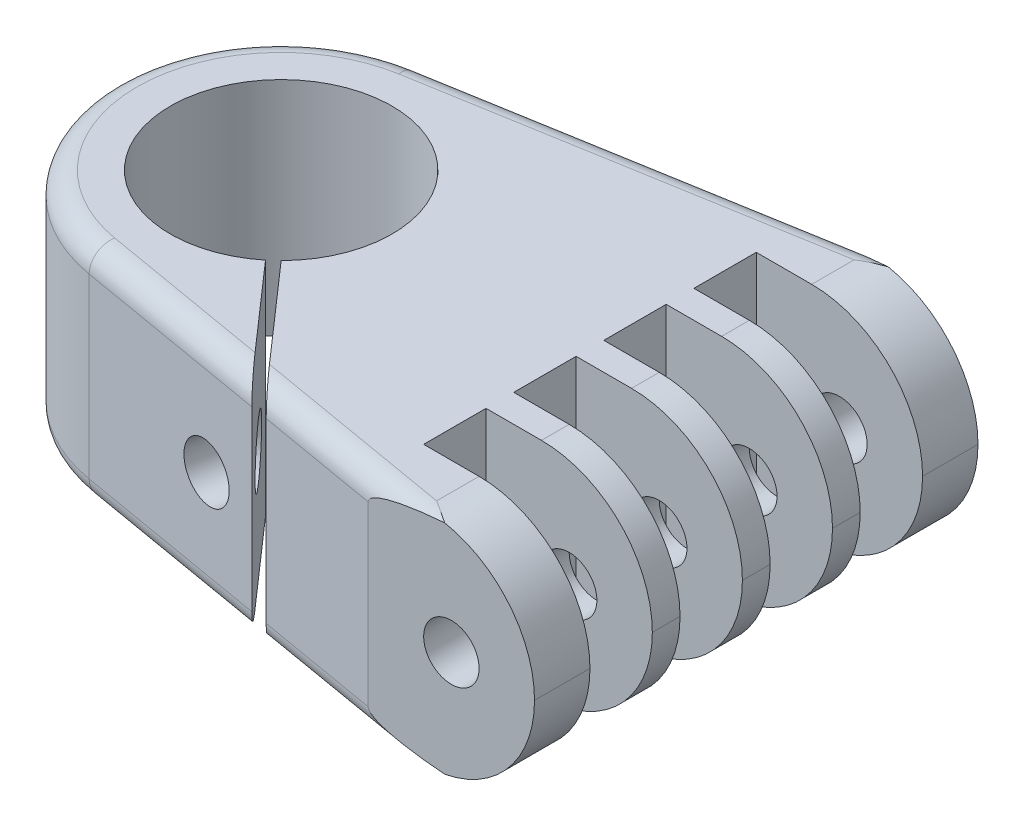
from build123d import *

# Parameters (mm, degrees)
BOSS_EXTRUDE1_DEPTH = 20
FILLET1_R           = 10
SKETCH2_R           = 2.5
CUT_EXTRUDE1_DEPTH  = 40
FILLET2_R           = 2
SKETCH3_R           = 2.5
CUT_EXTRUDE2_DEPTH  = 10


# Some blends are built 0.0001 mm under size
with BuildPart() as part:
    # Sketch1 → Boss-Extrude1 (new body)
    with BuildSketch(Plane(origin=(0, 0, 0), x_dir=(1, 0, 0), z_dir=(0, 1, 0))):
        with BuildLine():
            Line((27.849705815, 9.375), (27.849705815, 15))
            Line((27.849705815, 15), (42.849705815, 15))
            Line((42.849705815, 15), (42.849705815, 20))
            Line((42.849705815, 20), (27.849705815, 20))
            Line((27.849705815, 20), (-2.537743238, 14.78377013))
            ThreePointArc((-2.537743238, 14.78377013), (-15, 0), (-2.537743238, -14.78377013))
            Line((-2.537743238, -14.78377013), (15.176440556, -17.824540498))
            Line((15.176440556, -17.824540498), (6.327966589, -7.743180151))
            ThreePointArc((6.327966589, -7.743180151), (-6.707251498, 7.417059885), (7.069754095, -7.072381285))
            Line((7.069754095, -7.072381285), (16.743020962, -18.093455585))
            Line((16.743020962, -18.093455585), (27.849705815, -20))
            Line((27.849705815, -20), (42.849705815, -20))
            Line((42.849705815, -20), (42.849705815, -15))
            Line((42.849705815, -15), (27.849705815, -15))
            Line((27.849705815, -15), (27.849705815, -9.375))
            Line((27.849705815, -9.375), (42.849705815, -9.375))
            Line((42.849705815, -9.375), (42.849705815, -6.875))
            Line((42.849705815, -6.875), (27.849705815, -6.875))
            Line((27.849705815, -6.875), (27.849705815, -1.25))
            Line((27.849705815, -1.25), (42.849705815, -1.25))
            Line((42.849705815, -1.25), (42.849705815, 1.25))
            Line((42.849705815, 1.25), (27.849705815, 1.25))
            Line((27.849705815, 1.25), (27.849705815, 6.875))
            Line((27.849705815, 6.875), (42.849705815, 6.875))
            Line((42.849705815, 6.875), (42.849705815, 9.375))
            Line((42.849705815, 9.375), (27.849705815, 9.375))
        make_face()
    extrude(amount=BOSS_EXTRUDE1_DEPTH)

    # Fillet1
    fillet1_edges = [part.edges().sort_by_distance(p)[0] for p in [
        (42.849705815, 0, 17.5),
        (42.849705815, 0, 8.125),
        (42.849705815, 0, 0),
        (42.849705815, 0, -8.125),
        (42.849705815, 0, -17.5),
        (42.849705815, 20, -17.5),
        (42.849705815, 20, -8.125),
        (42.849705815, 20, 0),
        (42.849705815, 20, 8.125),
        (42.849705815, 20, 17.5),
    ]]
    fillet(fillet1_edges, radius=FILLET1_R - 0.0001)  # a hair under: the kernel refuses the full size

    # Sketch2 → Cut-Extrude1 (cut)
    with BuildSketch(Plane(origin=(0, 0, -20), x_dir=(-1, 0, 0), z_dir=(0, 0, -1))):
        with Locations((-35.349705815, 10)):
            Circle(SKETCH2_R)
    extrude(amount=-CUT_EXTRUDE1_DEPTH, mode=Mode.SUBTRACT)

    # Fillet2
    # the kernel refuses this fillet: 2 mm, written as the material it takes off along each edge
    with BuildSketch(Plane(origin=(39.676721919, 0, -22.03019459), x_dir=(0.16918288251037936, 0, 0.9855846753402162), z_dir=(-0.9855846753402161, 0, 0.16918288251037933))) as fillet2_piece_1:
        with BuildLine():
            CenterArc((FILLET2_R, FILLET2_R), FILLET2_R, 180, 90)
            Line((0, FILLET2_R), (-FILLET2_R * 0.02, FILLET2_R))
            Line((-FILLET2_R * 0.02, FILLET2_R), (-FILLET2_R * 0.02, -FILLET2_R * 0.02))
            Line((-FILLET2_R * 0.02, -FILLET2_R * 0.02), (FILLET2_R, -FILLET2_R * 0.02))
            Line((FILLET2_R, -FILLET2_R * 0.02), (FILLET2_R, 0))
        make_face()
    extrude(amount=42.831900914, mode=Mode.SUBTRACT)
    with BuildSketch(Plane(origin=(-2.537743238, 0, 14.78377013), x_dir=(0.16918288251037944, 0, -0.9855846753402161), z_dir=(0.9855846753402161, 0, 0.16918288251037944))) as fillet2_piece_2:
        with BuildLine():
            CenterArc((FILLET2_R, FILLET2_R), FILLET2_R, 180, 90)
            Line((0, FILLET2_R), (-FILLET2_R * 0.02, FILLET2_R))
            Line((-FILLET2_R * 0.02, FILLET2_R), (-FILLET2_R * 0.02, -FILLET2_R * 0.02))
            Line((-FILLET2_R * 0.02, -FILLET2_R * 0.02), (FILLET2_R, -FILLET2_R * 0.02))
            Line((FILLET2_R, -FILLET2_R * 0.02), (FILLET2_R, 0))
        make_face()
    extrude(amount=29.973274379, mode=Mode.SUBTRACT)
    with BuildSketch(Plane(origin=(39.676721919, 20, -22.03019459), x_dir=(0.16918288251037936, 0, 0.9855846753402162), z_dir=(-0.9855846753402161, 0, 0.16918288251037933))) as fillet2_piece_3:
        with BuildLine():
            CenterArc((FILLET2_R, -FILLET2_R), FILLET2_R, 90, 90)
            Line((0, -FILLET2_R), (-FILLET2_R * 0.02, -FILLET2_R))
            Line((-FILLET2_R * 0.02, -FILLET2_R), (-FILLET2_R * 0.02, FILLET2_R * 0.02))
            Line((-FILLET2_R * 0.02, FILLET2_R * 0.02), (FILLET2_R, FILLET2_R * 0.02))
            Line((FILLET2_R, FILLET2_R * 0.02), (FILLET2_R, 0))
        make_face()
    extrude(amount=42.831900914, mode=Mode.SUBTRACT)
    with BuildSketch(Plane(origin=(-2.537743238, 20, 14.78377013), x_dir=(0.16918288251037944, 0, -0.9855846753402161), z_dir=(0.9855846753402161, 0, 0.16918288251037944))) as fillet2_piece_4:
        with BuildLine():
            CenterArc((FILLET2_R, -FILLET2_R), FILLET2_R, 90, 90)
            Line((0, -FILLET2_R), (-FILLET2_R * 0.02, -FILLET2_R))
            Line((-FILLET2_R * 0.02, -FILLET2_R), (-FILLET2_R * 0.02, FILLET2_R * 0.02))
            Line((-FILLET2_R * 0.02, FILLET2_R * 0.02), (FILLET2_R, FILLET2_R * 0.02))
            Line((FILLET2_R, FILLET2_R * 0.02), (FILLET2_R, 0))
        make_face()
    extrude(amount=29.973274379, mode=Mode.SUBTRACT)
    with BuildSketch(Plane(origin=(4.916004858, 0, 16.063260995), x_dir=(0.16918288251037944, 0, -0.9855846753402161), z_dir=(0.9855846753402161, 0, 0.16918288251037944))) as fillet2_piece_5:
        with BuildLine():
            CenterArc((FILLET2_R, FILLET2_R), FILLET2_R, 180, 90)
            Line((0, FILLET2_R), (-FILLET2_R * 0.02, FILLET2_R))
            Line((-FILLET2_R * 0.02, FILLET2_R), (-FILLET2_R * 0.02, -FILLET2_R * 0.02))
            Line((-FILLET2_R * 0.02, -FILLET2_R * 0.02), (FILLET2_R, -FILLET2_R * 0.02))
            Line((FILLET2_R, -FILLET2_R * 0.02), (FILLET2_R, 0))
        make_face()
    extrude(amount=35.269133064, mode=Mode.SUBTRACT)
    with BuildSketch(Plane(origin=(4.916004858, 20, 16.063260995), x_dir=(0.16918288251037944, 0, -0.9855846753402161), z_dir=(0.9855846753402161, 0, 0.16918288251037944))) as fillet2_piece_6:
        with BuildLine():
            CenterArc((FILLET2_R, -FILLET2_R), FILLET2_R, 90, 90)
            Line((0, -FILLET2_R), (-FILLET2_R * 0.02, -FILLET2_R))
            Line((-FILLET2_R * 0.02, -FILLET2_R), (-FILLET2_R * 0.02, FILLET2_R * 0.02))
            Line((-FILLET2_R * 0.02, FILLET2_R * 0.02), (FILLET2_R, FILLET2_R * 0.02))
            Line((FILLET2_R, FILLET2_R * 0.02), (FILLET2_R, 0))
        make_face()
    extrude(amount=35.269133064, mode=Mode.SUBTRACT)
    with BuildSketch(Plane(origin=(0, 0, 0), x_dir=(-0.16918288251037905, 0, -0.9855846753402162), z_dir=(0.9855846753402162, 0, -0.16918288251037905))) as fillet2_piece_7:
        with BuildLine():
            CenterArc((15 - FILLET2_R, FILLET2_R), FILLET2_R, 270, 90)
            Line((15, FILLET2_R), (15 + FILLET2_R * 0.02, FILLET2_R))
            Line((15 + FILLET2_R * 0.02, FILLET2_R), (15 + FILLET2_R * 0.02, -FILLET2_R * 0.02))
            Line((15 + FILLET2_R * 0.02, -FILLET2_R * 0.02), (15 - FILLET2_R, -FILLET2_R * 0.02))
            Line((15 - FILLET2_R, -FILLET2_R * 0.02), (15 - FILLET2_R, 0))
        make_face()
    revolve(axis=Axis((0, 0, 0), (0, 1, 0)), revolution_arc=160.519372943, mode=Mode.SUBTRACT)
    with BuildSketch(Plane(origin=(0, 20, 0), x_dir=(-0.16918288251037905, 0, -0.9855846753402162), z_dir=(0.9855846753402162, 0, -0.16918288251037905))) as fillet2_piece_8:
        with BuildLine():
            CenterArc((15 - FILLET2_R, -FILLET2_R), FILLET2_R, 0, 90)
            Line((15, -FILLET2_R), (15 + FILLET2_R * 0.02, -FILLET2_R))
            Line((15 + FILLET2_R * 0.02, -FILLET2_R), (15 + FILLET2_R * 0.02, FILLET2_R * 0.02))
            Line((15 + FILLET2_R * 0.02, FILLET2_R * 0.02), (15 - FILLET2_R, FILLET2_R * 0.02))
            Line((15 - FILLET2_R, FILLET2_R * 0.02), (15 - FILLET2_R, 0))
        make_face()
    revolve(axis=Axis((0, 20, 0), (0, 1, 0)), revolution_arc=160.519372943, mode=Mode.SUBTRACT)

    # Sketch3 → Cut-Extrude2 (cut)
    with BuildSketch(Plane(origin=(-2.537743238, 0, 14.78377013), x_dir=(0.9855846753402161, 0, 0.16918288251037955), z_dir=(-0.16918288251037955, 0, 0.9855846753402161))):
        with Locations((12.973274379, 10)):
            Circle(SKETCH3_R)
    extrude(amount=-CUT_EXTRUDE2_DEPTH, mode=Mode.SUBTRACT)


solid = part.part
